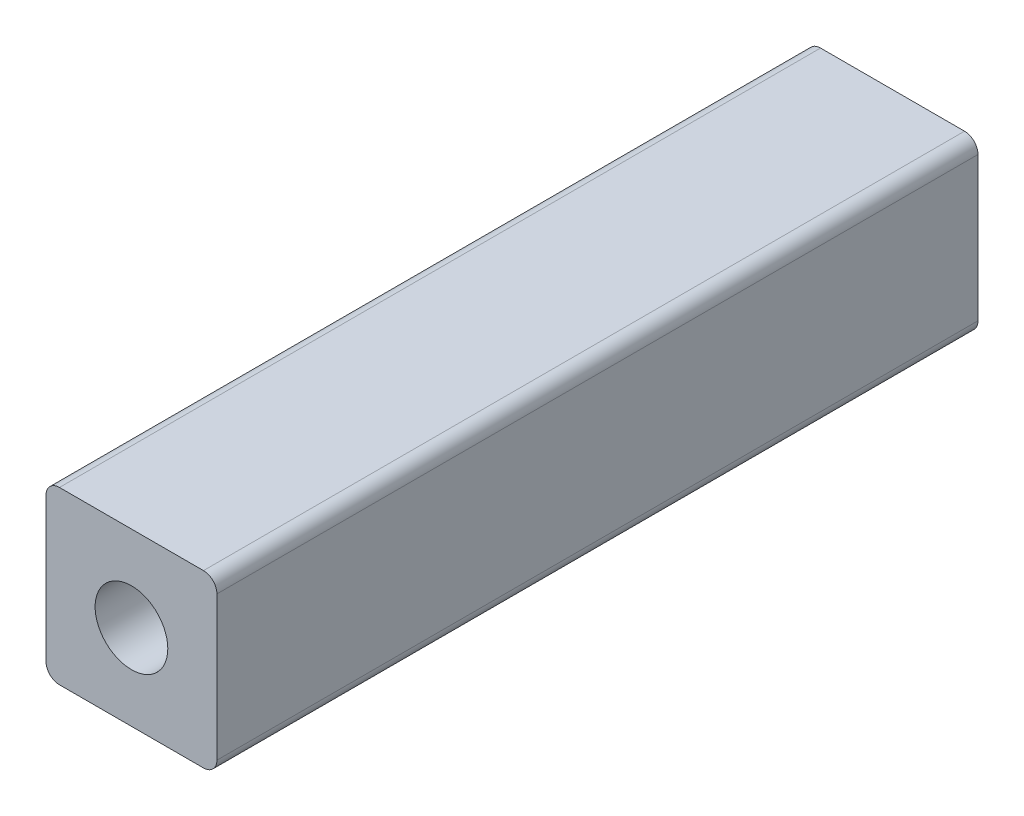
from build123d import *

# Parameters (mm, degrees)
SKETCH1_W           = 12.7
SKETCH1_H           = 12.7
SKETCH1_R           = 2.7
BOSS_EXTRUDE1_DEPTH = 28.275
FILLET2_R           = 1


with BuildPart() as part:
    # Sketch1 → Boss-Extrude1 (new, symmetric)
    with BuildSketch(Plane.XY):
        Rectangle(SKETCH1_W, SKETCH1_H)
        Circle(SKETCH1_R, mode=Mode.SUBTRACT)
    extrude(amount=BOSS_EXTRUDE1_DEPTH, both=True)

    # Fillet2
    fillet2_edges = [part.edges().sort_by_distance(p)[0] for p in [
        (-6.35, -6.35, 0),
        (-6.35, 6.35, 0),
        (6.35, 6.35, 0),
        (6.35, -6.35, 0),
    ]]
    fillet(fillet2_edges, radius=FILLET2_R)


solid = part.part
